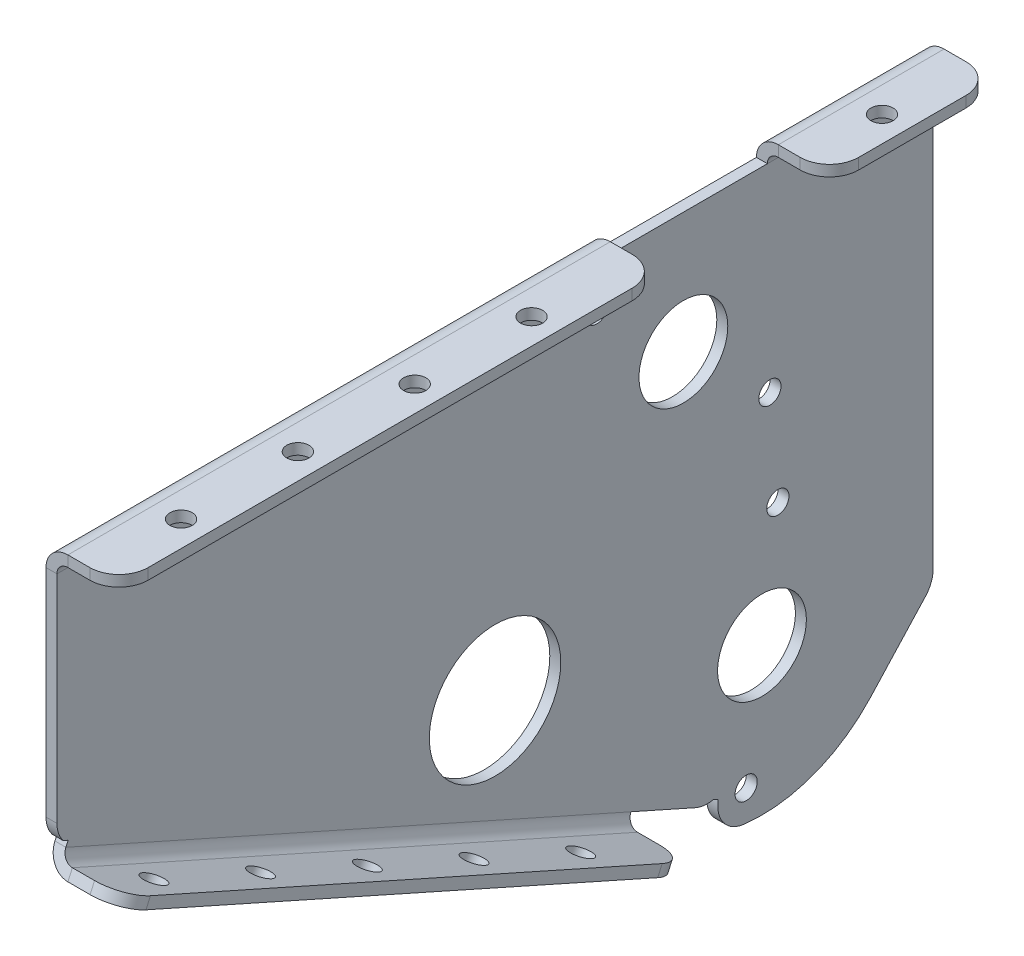
from build123d import *

# Parameters (mm, degrees)
SKETCH10_R                    = 14.2875
SKETCH10_R_2                  = 9.652
BASE_FLANGE2_DEPTH            = 2.38125
EDGE_FLANGE1_STRIP_W          = 14.2875
EDGE_FLANGE1_STRIP_H          = 2.38125
EDGE_FLANGE1_STRIP_CUT_DEPTH  = 190.5
EDGE_FLANGE1_DEPTH            = 190.5
EDGE_FLANGE2_STRIP_W          = 14.2875
EDGE_FLANGE2_STRIP_H          = 2.38125
EDGE_FLANGE2_STRIP_CUT_DEPTH  = 153.561109876
EDGE_FLANGE2_RELIEF_W         = 15.478125
EDGE_FLANGE2_RELIEF_H         = 1.190625
EDGE_FLANGE2_RELIEF_CUT_DEPTH = 2.38125
EDGE_FLANGE2_DEPTH            = 153.561109876
SKETCH21_R                    = 2.413
CUT_EXTRUDE3_DEPTH            = 2.38125
SKETCH22_R                    = 2.413
CUT_EXTRUDE4_DEPTH            = 2.38125
SKETCH23_R                    = 2.413
CUT_EXTRUDE5_DEPTH            = 2.38125
FILLET2_R                     = 6.35
FILLET4_R                     = 6.35
CUT_EXTRUDE7_START            = -2.38125
CUT_EXTRUDE7_OUTLINE_W        = 36.530187032
CUT_EXTRUDE7_OUTLINE_H        = 4.7625
CUT_EXTRUDE7_DEPTH            = 15.875
FILLET5_R                     = 6.35
CUT_EXTRUDE8_START            = -2.38125
CUT_EXTRUDE8_DEPTH            = 15.9385
FILLET6_R                     = 6.35


# Read off the part's stored shape, not the designer's step: Cut-Extrude7, Cut-Extrude8
# Sheet-metal steps are written as plain solids
with BuildPart() as part:
    # Sketch10 → Base-Flange2 (new body)
    with BuildSketch(Plane(origin=(0, 0, 0), x_dir=(0, 0, -1), z_dir=(1, 0, 0))):
        with BuildLine():
            Line((95.25, 50.8), (-95.25, 50.8))
            Line((-95.25, 50.8), (-95.25, -10.766571942))
            Line((-95.25, -10.766571942), (45.017152523, -73.265695051))
            ThreePointArc((45.017152523, -73.265695051), (64.55538961, -75.366663588), (81.638275588, -65.654208495))
            Line((81.638275588, -65.654208495), (95.25, -50.8))
            Line((95.25, -50.8), (95.25, 50.8))
        make_face()
        with Locations((0, -25.4)):
            Circle(SKETCH10_R, mode=Mode.SUBTRACT)
        with Locations((40.950318971, 19.757424375)):
            Circle(SKETCH10_R_2, mode=Mode.SUBTRACT)
        with Locations((58.042728709, -44.032317193)):
            Circle(SKETCH10_R_2, mode=Mode.SUBTRACT)
    extrude(amount=-BASE_FLANGE2_DEPTH)

    # Edge-Flange1 strip (across the edge) → Edge-Flange1 strip cut (cut)
    with BuildSketch(Plane(origin=(0, 50.8, -95.25), x_dir=(0, -1, 0), z_dir=(0, 0, 1))):
        with Locations((-2.38125, -1.190625)):
            Rectangle(EDGE_FLANGE1_STRIP_W, EDGE_FLANGE1_STRIP_H)
    extrude(amount=EDGE_FLANGE1_STRIP_CUT_DEPTH, mode=Mode.SUBTRACT)

    # Edge-Flange1 section (across the edge) → Edge-Flange1 (add)
    with BuildSketch(Plane(origin=(0, 50.8, -95.25), x_dir=(0, -1, 0), z_dir=(0, 0, 1))):
        with BuildLine():
            Line((0, 2.38125), (0, 13.49375))
            Line((0, 13.49375), (2.38125, 13.49375))
            Line((2.38125, 13.49375), (2.38125, 2.38125))
            ThreePointArc((2.38125, 2.38125), (3.078701977, 0.697451977), (4.7625, 0))
            Line((4.7625, 0), (4.7625, -2.38125))
            ThreePointArc((4.7625, -2.38125), (1.394903955, -0.986346045), (0, 2.38125))
        make_face()
    extrude(amount=EDGE_FLANGE1_DEPTH)

    # Edge-Flange2 strip (across the edge) → Edge-Flange2 strip cut (cut)
    with BuildSketch(Plane(origin=(0, -10.766571942, 95.25), x_dir=(3.4914813388431334e-15, 0.9134288794629325, -0.40699838103251906), z_dir=(0, -0.40699838103251906, -0.9134288794629325))):
        with Locations((-2.38125, -1.190625)):
            Rectangle(EDGE_FLANGE2_STRIP_W, EDGE_FLANGE2_STRIP_H)
    extrude(amount=EDGE_FLANGE2_STRIP_CUT_DEPTH, mode=Mode.SUBTRACT)

    # Edge-Flange2 relief (on the sheet) → Edge-Flange2 relief cut (cut)
    with BuildSketch(Plane(origin=(0, -6.416366904, 93.31167021), x_dir=(6.982962677686267e-15, 0.9134288794629325, -0.40699838103251906), z_dir=(1, 0, 0))):
        with Locations((-6.5484375, 0.5953125)):
            Rectangle(EDGE_FLANGE2_RELIEF_W, EDGE_FLANGE2_RELIEF_H)
        with Locations((-6.5484375, -154.156422376)):
            Rectangle(EDGE_FLANGE2_RELIEF_W, EDGE_FLANGE2_RELIEF_H)
    extrude(amount=-EDGE_FLANGE2_RELIEF_CUT_DEPTH, mode=Mode.SUBTRACT)

    # Edge-Flange2 section (across the edge) → Edge-Flange2 (add)
    with BuildSketch(Plane(origin=(0, -10.766571942, 95.25), x_dir=(3.4914813388431334e-15, 0.9134288794629325, -0.40699838103251906), z_dir=(0, -0.40699838103251906, -0.9134288794629325))):
        with BuildLine():
            Line((0, 2.38125), (0, 13.55725))
            Line((0, 13.55725), (2.38125, 13.55725))
            Line((2.38125, 13.55725), (2.38125, 2.38125))
            ThreePointArc((2.38125, 2.38125), (3.078701977, 0.697451977), (4.7625, 0))
            Line((4.7625, 0), (4.7625, -2.38125))
            ThreePointArc((4.7625, -2.38125), (1.394903955, -0.986346045), (0, 2.38125))
        make_face()
    extrude(amount=EDGE_FLANGE2_DEPTH)

    # Sketch21 → Cut-Extrude3 (cut)
    with BuildSketch(Plane(origin=(0, -44.393642411, 19.780566387), x_dir=(1, 0, 0), z_dir=(2.703292974137029e-15, -0.9134288794629322, 0.40699838103251995))):
        with Locations(Location((7.96925, 69.341568481, 0), (0, 0, 270))):
            Circle(SKETCH21_R)
        with Locations(Location((7.96925, 43.941568481, 0), (0, 0, 270))):
            Circle(SKETCH21_R)
        with Locations(Location((7.96925, 18.541568481, 0), (0, 0, 270))):
            Circle(SKETCH21_R)
        with Locations(Location((7.96925, -6.858431519, 0), (0, 0, 270))):
            Circle(SKETCH21_R)
        with Locations(Location((7.96925, -32.258431519, 0), (0, 0, 270))):
            Circle(SKETCH21_R)
        with Locations(Location((7.96925, -57.658431519, 0), (0, 0, 270))):
            Circle(SKETCH21_R)
    extrude(amount=-CUT_EXTRUDE3_DEPTH, mode=Mode.SUBTRACT)

    # Sketch22 → Cut-Extrude4 (cut)
    with BuildSketch(Plane(origin=(0, 50.8, 0), x_dir=(1, 0, 0), z_dir=(0, 1, 0))):
        with Locations(Location((7.9375, 76.2, 0), (0, 0, 180))):
            Circle(SKETCH22_R)
        with Locations(Location((7.9375, 50.8, 0), (0, 0, 180))):
            Circle(SKETCH22_R)
        with Locations(Location((7.9375, 25.4, 0), (0, 0, 180))):
            Circle(SKETCH22_R)
        with Locations(Location((7.9375, 0, 0), (0, 0, 180))):
            Circle(SKETCH22_R)
        with Locations(Location((7.9375, -25.4, 0), (0, 0, 180))):
            Circle(SKETCH22_R)
        with Locations(Location((7.9375, -50.8, 0), (0, 0, 180))):
            Circle(SKETCH22_R)
        with Locations(Location((7.9375, -76.2, 0), (0, 0, 180))):
            Circle(SKETCH22_R)
    extrude(amount=-CUT_EXTRUDE4_DEPTH, mode=Mode.SUBTRACT)

    # Sketch23 → Cut-Extrude5 (cut)
    with BuildSketch(Plane.ZY.offset(2.38125)):
        with Locations((-59.76591246, 2.694791471)):
            Circle(SKETCH23_R)
        with Locations((-22.134725481, 36.82005728)):
            Circle(SKETCH23_R)
        with Locations((-61.488660526, -18.867151708)):
            Circle(SKETCH23_R)
        with Locations((-54.596796892, -69.197482678)):
            Circle(SKETCH23_R)
    extrude(amount=-CUT_EXTRUDE5_DEPTH, mode=Mode.SUBTRACT)

    # Fillet2
    fillet2_edges = [part.edges().sort_by_distance(p)[0] for p in [
        (13.55725, -72.178143792, -45.50173497),
        (-1.190625, -50.8, -95.25),
        (13.49375, 49.609375, -95.25),
        (13.49375, 49.609375, 95.25),
        (13.55725, -9.679020683, 94.765417553),
    ]]
    fillet(fillet2_edges, radius=FILLET2_R)

    # Fillet4
    # the kernel refuses this fillet: 6.35 mm, written as the material it takes off along each edge
    with BuildSketch(Plane(origin=(-22.651866405, -73.730040746, -46.113720714), x_dir=(0, -0.2521852230713813, -0.9676789825476411), z_dir=(1, 0, 0))) as fillet4_piece_1:
        with BuildLine():
            CenterArc((7.303857022, 6.298845725), FILLET4_R, 184.042725935, 93.234799209)
            Line((0.969657378, 5.851168528), (0, 0))
            ThreePointArc((0, 0), (4.054123281, -0.257817546), (8.108246562, 0))
        make_face()
    extrude(amount=42.92248281, mode=Mode.SUBTRACT)
    with BuildSketch(Plane(origin=(17.231459324, -7.841191755, 95.25), x_dir=(0, 1, 0), z_dir=(-1, 0, 0))) as fillet4_piece_2:
        with BuildLine():
            CenterArc((6.89258373, 6.35), FILLET4_R, 232.158132329, 37.841867671)
            Line((2.996958559, 1.335360977), (0, 0))
            Line((0, 0), (6.89258373, 0))
        make_face()
    extrude(amount=36.844168648, mode=Mode.SUBTRACT)

    # Cut-Extrude7 outline → Cut-Extrude7 (cut)
    with BuildSketch(Plane(origin=(0, 0, 0), x_dir=(0, 0, -1), z_dir=(1, 0, 0)).offset(CUT_EXTRUDE7_START)):
        with Locations((40.950318971, 48.41875)):
            Rectangle(CUT_EXTRUDE7_OUTLINE_W, CUT_EXTRUDE7_OUTLINE_H)
    extrude(amount=CUT_EXTRUDE7_DEPTH, mode=Mode.SUBTRACT)

    # Fillet5
    fillet5_edges = [part.edges().sort_by_distance(p)[0] for p in [
        (13.49375, 49.609375, -22.685225455),
        (13.49375, 49.609375, -59.215412487),
    ]]
    fillet(fillet5_edges, radius=FILLET5_R)

    # Cut-Extrude8 outline → Cut-Extrude8 (cut)
    with BuildSketch(Plane(origin=(0, 0, 0), x_dir=(0, 0, -1), z_dir=(1, 0, 0)).offset(CUT_EXTRUDE8_START)):
        Polygon((45.017152523, -73.265695051), (46.955482312, -68.915490013), (29.554662159, -61.162170854), (28.585497264, -63.337273373), (27.616332369, -65.512375893), align=None)
    extrude(amount=CUT_EXTRUDE8_DEPTH, mode=Mode.SUBTRACT)

    # Fillet6
    # the kernel refuses this fillet: 6.35 mm, written as the material it takes off along each edge
    with BuildSketch(Plane(origin=(-11.635758905, -68.915490013, -46.955482312), x_dir=(0, 0.913428879463083, -0.4069983810321814), z_dir=(1, 0, 0))) as fillet6_piece_1:
        with BuildLine():
            CenterArc((6.35, 3.701803562), FILLET6_R, 179.999999998, 35.6590877)
            Line((0, 3.701803562), (-0.127, 3.701803562))
            Line((-0.127, 3.701803562), (-0.127, 0))
            Line((-0.127, 0), (0, -0.127))
            ThreePointArc((0, -0.127), (0.5953125, -0.127), (1.0874375, -0.074036071))
            Line((1.0874375, -0.074036071), (1.190625, 0))
        make_face()
    extrude(amount=20.890267809, mode=Mode.SUBTRACT)
    with BuildSketch(Plane(origin=(13.55725, -48.836589911, -35.046596562), x_dir=(-1, 0, 0), z_dir=(0, -0.913428879491149, 0.4069983809691926))) as fillet6_piece_2:
        with BuildLine():
            CenterArc((FILLET6_R, -FILLET6_R), FILLET6_R, 90, 90)
            Line((0, -FILLET6_R), (-FILLET6_R * 0.02, -FILLET6_R))
            Line((-FILLET6_R * 0.02, -FILLET6_R), (-FILLET6_R * 0.02, FILLET6_R * 0.02))
            Line((-FILLET6_R * 0.02, FILLET6_R * 0.02), (FILLET6_R, FILLET6_R * 0.02))
            Line((FILLET6_R, FILLET6_R * 0.02), (FILLET6_R, 0))
        make_face()
    extrude(amount=34.131250001, mode=Mode.SUBTRACT)


solid = part.part
